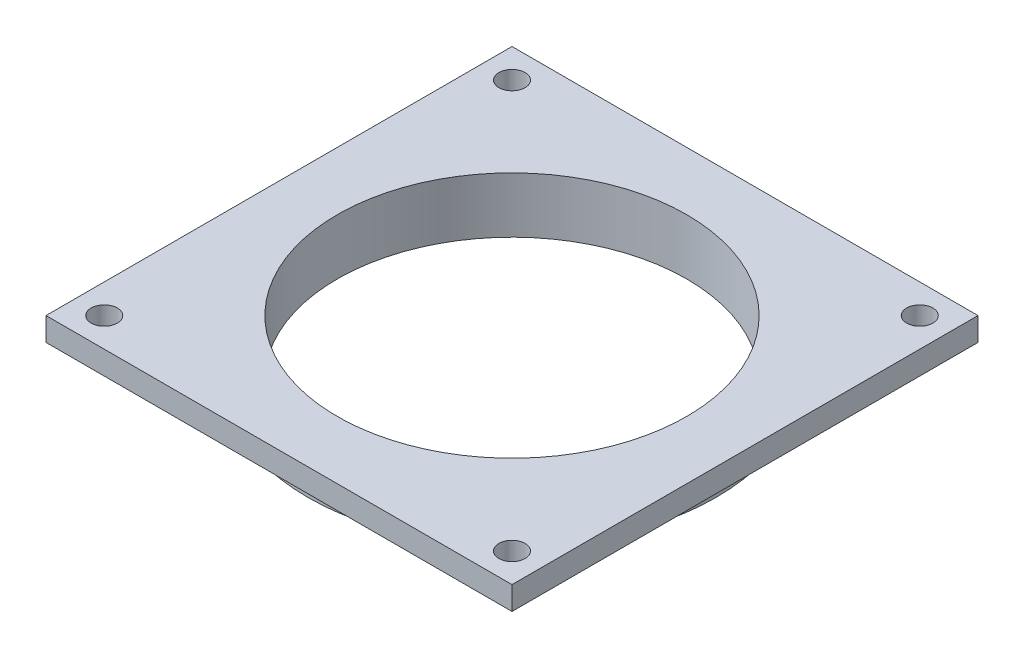
from build123d import *

# Parameters (mm, degrees)
SKETCH1_R           = 35
SKETCH1_R_2         = 30
BOSS_EXTRUDE1_DEPTH = 5.5626
SKETCH2_W           = 80
SKETCH2_H           = 80
SKETCH2_R           = 2.25
SKETCH2_R_2         = 30
BOSS_EXTRUDE3_DEPTH = 4


with BuildPart() as part:
    # Sketch1 → Boss-Extrude1 (new body)
    with BuildSketch(Plane(origin=(0, 0, 0), x_dir=(1, 0, 0), z_dir=(0, 1, 0))):
        Circle(SKETCH1_R)
        Circle(SKETCH1_R_2, mode=Mode.SUBTRACT)
    extrude(amount=BOSS_EXTRUDE1_DEPTH)

    # Sketch2 → Boss-Extrude3 (add)
    with BuildSketch(Plane(origin=(0, 5.5626, 0), x_dir=(1, 0, 0), z_dir=(0, 1, 0))):
        Rectangle(SKETCH2_W, SKETCH2_H)
        with Locations((-35, -35)):
            Circle(SKETCH2_R, mode=Mode.SUBTRACT)
        with Locations((35, -35)):
            Circle(SKETCH2_R, mode=Mode.SUBTRACT)
        with Locations((35, 35)):
            Circle(SKETCH2_R, mode=Mode.SUBTRACT)
        with Locations((-35, 35)):
            Circle(SKETCH2_R, mode=Mode.SUBTRACT)
        Circle(SKETCH2_R_2, mode=Mode.SUBTRACT)
    extrude(amount=BOSS_EXTRUDE3_DEPTH)


solid = part.part
